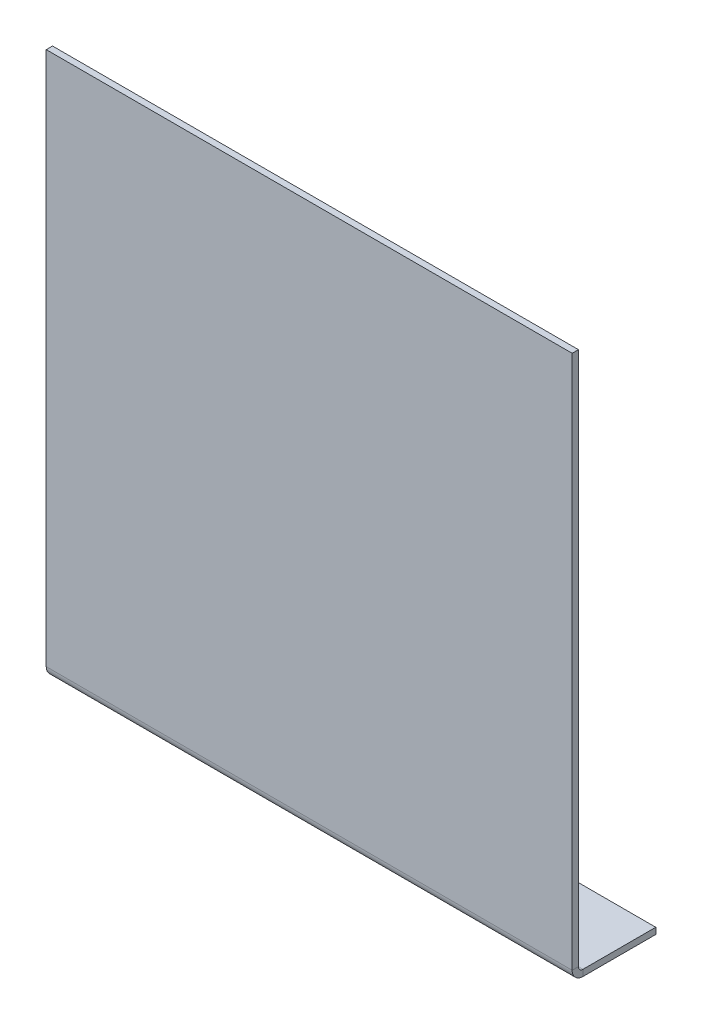
from build123d import *

# Parameters (mm, degrees)
SKETCH1_W              = 85
SKETCH1_H              = 100
SKETCH1_R              = 1.4732
BASE_FLANGE1_DEPTH     = 1.016
SKETCHED_BEND1_DEPTH   = 85
SKETCHED_BEND1_2_DEPTH = 85


# Read off the part's stored shape, not the designer's step: Sketched Bend1
# Sheet-metal steps are written as plain solids
with BuildPart() as part:
    # Sketch1 → Base-Flange1 (new body)
    with BuildSketch(Plane(origin=(0, 0, 0), x_dir=(1, 0, 0), z_dir=(0, 1, 0))):
        with Locations((42.5, -50)):
            Rectangle(SKETCH1_W, SKETCH1_H)
        with Locations(Location((10, -7, 0), (0, 0, 270))):
            Circle(SKETCH1_R, mode=Mode.SUBTRACT)
        with Locations(Location((75, -7, 0), (0, 0, 270))):
            Circle(SKETCH1_R, mode=Mode.SUBTRACT)
    extrude(amount=-BASE_FLANGE1_DEPTH)

    # Sketched Bend1 outline → Sketched Bend1 (cut)
    with BuildSketch(Plane.YZ):
        with BuildLine():
            ThreePointArc((-1.016, 11.762391673), (-0.740317723, 12.705959794), (0, 13.352683218))
            Line((0, 13.352683218), (0, 100))
            Line((0, 100), (-1.016, 100))
            Line((-1.016, 100), (-1.016, 11.762391673))
        make_face()
    extrude(amount=SKETCHED_BEND1_DEPTH, mode=Mode.SUBTRACT)

    # Sketched Bend1 2 outline → Sketched Bend1 2 (add)
    with BuildSketch(Plane.YZ):
        with BuildLine():
            ThreePointArc((0, 11.762391673), (0.215745145, 12.283246528), (0.7366, 12.498991673))
            Line((0.7366, 12.498991673), (87.098991673, 12.498991673))
            Line((87.098991673, 12.498991673), (87.098991673, 13.514991673))
            Line((87.098991673, 13.514991673), (0.7366, 13.514991673))
            ThreePointArc((0.7366, 13.514991673), (0.35946488, 13.473933627), (0, 13.352683218))
            Line((0, 13.352683218), (0, 11.762391673))
        make_face()
    extrude(amount=SKETCHED_BEND1_2_DEPTH)


solid = part.part
